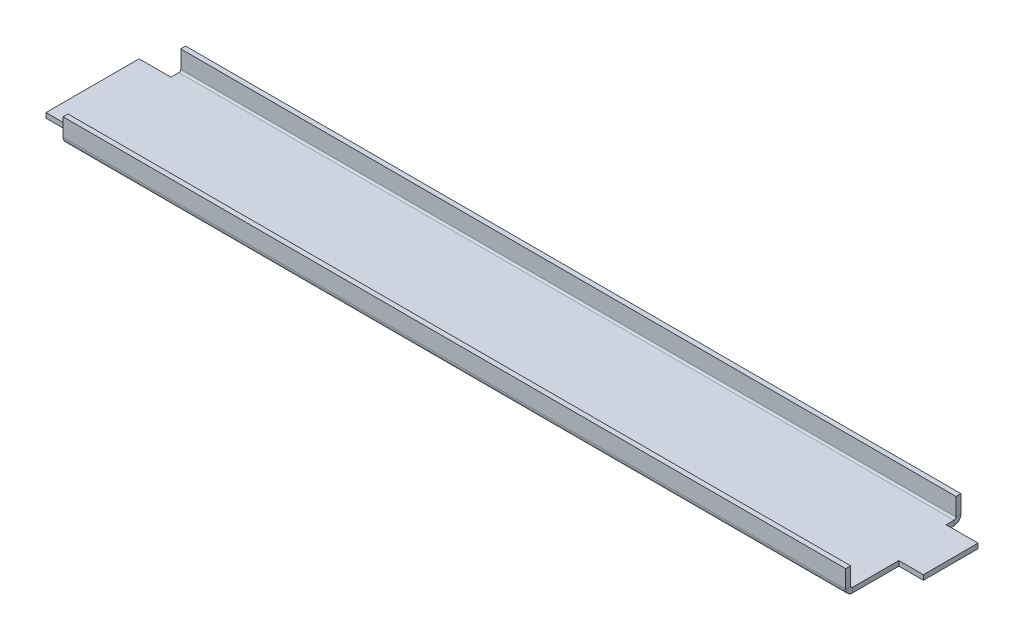
from build123d import *

# Parameters (mm, degrees)
SKETCH1_W                    = 342.4
SKETCH1_H                    = 50
BASE_FLANGE1_DEPTH           = 2
EDGE_FLANGE1_STRIP_W         = 9.4732
EDGE_FLANGE1_STRIP_H         = 2
EDGE_FLANGE1_STRIP_CUT_DEPTH = 342.4
EDGE_FLANGE1_DEPTH           = 342.4
EDGE_FLANGE2_STRIP_W         = 9.4732
EDGE_FLANGE2_STRIP_H         = 2
EDGE_FLANGE2_STRIP_CUT_DEPTH = 342.4
EDGE_FLANGE2_DEPTH           = 342.4
CUT_EXTRUDE2_DEPTH           = 334.488770426
CUT_EXTRUDE3_DEPTH           = 174.200577366
MOVE_START                   = 158.2
MOVE_FACE1_DEPTH             = 3


# Read off the part's stored shape, not the designer's step: Move Face1
# Sheet-metal steps are written as plain solids
with BuildPart() as part:
    # Sketch1 → Base-Flange1 (new body)
    with BuildSketch(Plane(origin=(0, 0, 0), x_dir=(1, 0, 0), z_dir=(0, 1, 0))):
        Rectangle(SKETCH1_W, SKETCH1_H)
    extrude(amount=BASE_FLANGE1_DEPTH)

    # Edge-Flange1 strip (across the edge) → Edge-Flange1 strip cut (cut)
    with BuildSketch(Plane(origin=(-171.2, 2, 25), x_dir=(0, 0, -1), z_dir=(1, 0, 0))):
        with Locations((-2, -1)):
            Rectangle(EDGE_FLANGE1_STRIP_W, EDGE_FLANGE1_STRIP_H)
    extrude(amount=EDGE_FLANGE1_STRIP_CUT_DEPTH, mode=Mode.SUBTRACT)

    # Edge-Flange1 section (across the edge) → Edge-Flange1 (add)
    with BuildSketch(Plane(origin=(-171.2, 2, 25), x_dir=(0, 0, -1), z_dir=(1, 0, 0))):
        with BuildLine():
            Line((0, 0.7366), (0, 8))
            Line((0, 8), (2, 8))
            Line((2, 8), (2, 0.7366))
            ThreePointArc((2, 0.7366), (2.215745145, 0.215745145), (2.7366, 0))
            Line((2.7366, 0), (2.7366, -2))
            ThreePointArc((2.7366, -2), (0.801531583, -1.198468417), (0, 0.7366))
        make_face()
    extrude(amount=EDGE_FLANGE1_DEPTH)

    # Edge-Flange2 strip (across the edge) → Edge-Flange2 strip cut (cut)
    with BuildSketch(Plane(origin=(171.2, 2, -25), x_dir=(0, 0, 1), z_dir=(-1, 0, 0))):
        with Locations((-2, -1)):
            Rectangle(EDGE_FLANGE2_STRIP_W, EDGE_FLANGE2_STRIP_H)
    extrude(amount=EDGE_FLANGE2_STRIP_CUT_DEPTH, mode=Mode.SUBTRACT)

    # Edge-Flange2 section (across the edge) → Edge-Flange2 (add)
    with BuildSketch(Plane(origin=(171.2, 2, -25), x_dir=(0, 0, 1), z_dir=(-1, 0, 0))):
        with BuildLine():
            Line((0, 0.7366), (0, 8))
            Line((0, 8), (2, 8))
            Line((2, 8), (2, 0.7366))
            ThreePointArc((2, 0.7366), (2.215745145, 0.215745145), (2.7366, 0))
            Line((2.7366, 0), (2.7366, -2))
            ThreePointArc((2.7366, -2), (0.801531583, -1.198468417), (0, 0.7366))
        make_face()
    extrude(amount=EDGE_FLANGE2_DEPTH)

    # Sketch18 → Cut-Extrude2 (cut, through all)
    with BuildSketch(Plane(origin=(161.2, 0, 0), x_dir=(0, 0, -1), z_dir=(1, 0, 0))):
        Polygon((-3.3, 6.000000001), (-3.3, 10.000000001), (-37.658134746, 10.000000001), (-37.658134746, -5.535311506), (-3.3, -5.535311506), align=None)
    extrude(amount=CUT_EXTRUDE2_DEPTH, mode=Mode.SUBTRACT)

    # Sketch19 → Cut-Extrude3 (cut, symmetric)
    with BuildSketch(Plane(origin=(0, 2, 0), x_dir=(1, 0, 0), z_dir=(0, 1, 0))):
        Polygon((-249.45231786, 85.285820153), (-158.2, 85.285820153), (-158.2, 19), (-209.845513649, 19), (-209.845513649, -19), (-158.2, -19), (-158.2, -89.848436046), (-249.45231786, -89.848436046), align=None)
    cut_extrude3 = extrude(amount=CUT_EXTRUDE3_DEPTH, both=True, mode=Mode.SUBTRACT)

    # Mirror1: Cut-Extrude3 across plane
    add(cut_extrude3.mirror(Plane(origin=(0, 0, 0), x_dir=(0, 0, 1), z_dir=(1, 0, 0))), mode=Mode.SUBTRACT)

    # Move Face1 outline → Move Face1 (add)
    with BuildSketch(Plane.YZ.offset(MOVE_START)):
        with BuildLine():
            Line((0, 19), (2, 19))
            Line((2, 19), (2, 22.2634))
            ThreePointArc((2, 22.2634), (2.215745145, 22.784254855), (2.7366, 23))
            Line((2.7366, 23), (10.000000001, 23))
            Line((10.000000001, 23), (10, 25))
            Line((10, 25), (2.7366, 25))
            ThreePointArc((2.7366, 25), (0.801531583, 24.198468417), (0, 22.2634))
            Line((0, 22.2634), (0, 19))
        make_face()
    extrude(amount=MOVE_FACE1_DEPTH)


solid = part.part
